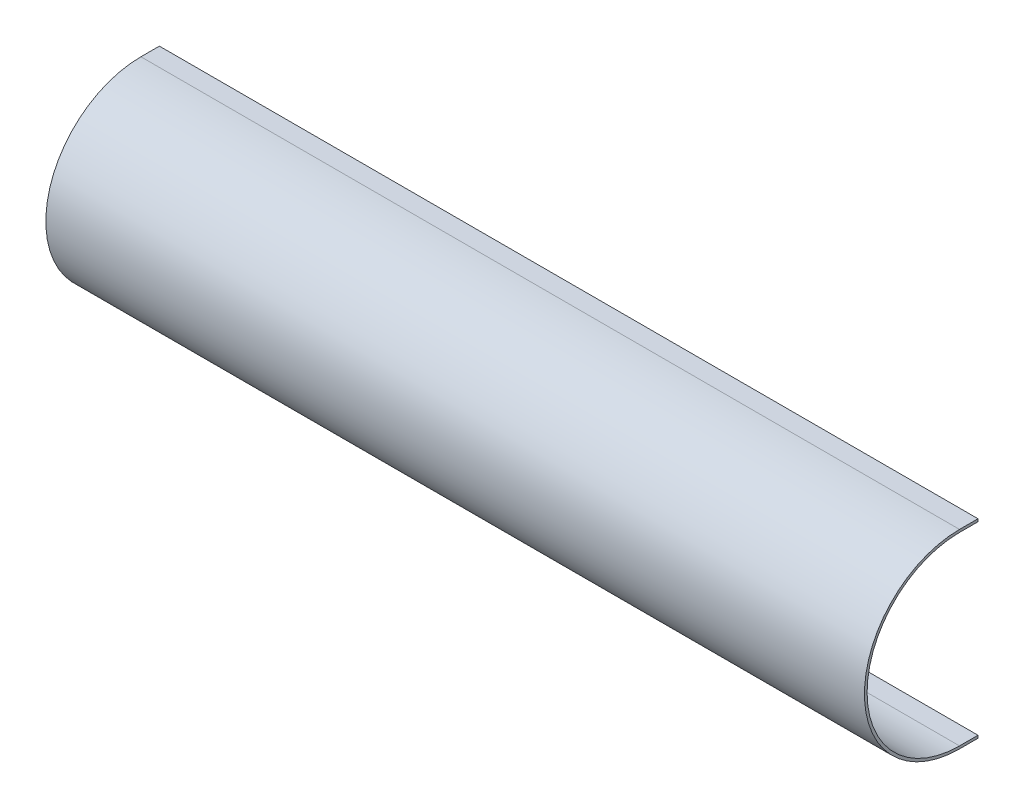
from build123d import *

# Parameters (mm, degrees)
BOSS_EXTRUDE1_DEPTH = 310


with BuildPart() as part:
    # Sketch1 → Boss-Extrude1 (new body)
    with BuildSketch(Plane(origin=(0, 0, 0), x_dir=(0, 0, -1), z_dir=(1, 0, 0))):
        with BuildLine():
            ThreePointArc((0, -35), (-35, 0), (0, 35))
            Line((0, 35), (7, 35))
            Line((7, 35), (7, 36))
            Line((7, 36), (0, 36))
            ThreePointArc((0, 36), (-36, 0), (0, -36))
            Line((0, -36), (7, -36))
            Line((7, -36), (7, -35))
            Line((7, -35), (0, -35))
        make_face()
    extrude(amount=BOSS_EXTRUDE1_DEPTH)


solid = part.part
